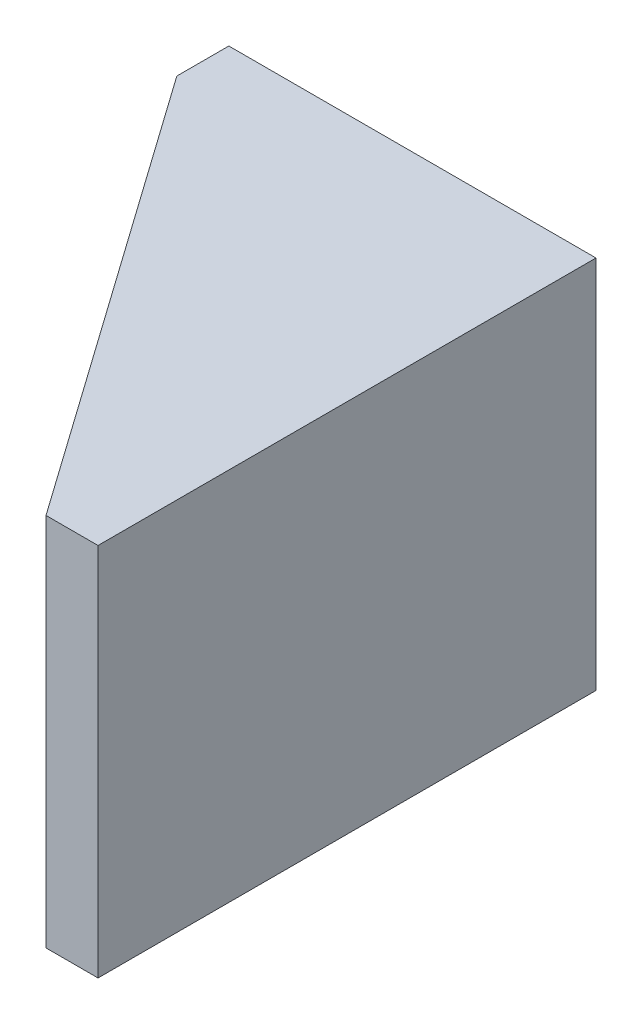
from build123d import *

# Parameters (mm, degrees)
BOSS_EXTRUDE1_DEPTH = 50.4
SKETCH3_R           = 11.5
SKETCH3_R_2         = 1.5
CUT_EXTRUDE1_DEPTH  = 90.095005472
BOSS_EXTRUDE2_DEPTH = 4


with BuildPart() as part:
    # Sketch2 → Boss-Extrude1 (new body)
    with BuildSketch(Plane(origin=(0, 0, 0), x_dir=(1, 0, 0), z_dir=(0, 1, 0))):
        Polygon((-42.4, 0), (0, 0), (0, -60), (7, -60), (7, 7), (-42.4, 7), align=None)
    extrude(amount=BOSS_EXTRUDE1_DEPTH)

    # Sketch3 → Cut-Extrude1 (cut, through all)
    with BuildSketch(Plane.XY):
        with Locations((-21.2, 25.2)):
            Circle(SKETCH3_R)
        with Locations((-36.7, 40.7)):
            Circle(SKETCH3_R_2)
        with Locations((-5.7, 40.7)):
            Circle(SKETCH3_R_2)
        with Locations((-5.7, 9.7)):
            Circle(SKETCH3_R_2)
        with Locations((-36.7, 9.7)):
            Circle(SKETCH3_R_2)
    extrude(amount=-CUT_EXTRUDE1_DEPTH, mode=Mode.SUBTRACT)

    # Sketch4 → Boss-Extrude2 (add)
    with BuildSketch(Plane(origin=(0, 50.4, 0), x_dir=(1, 0, 0), z_dir=(0, 1, 0))):
        Polygon((-42.4, 7), (7, 7), (7, -60), (0, -60), (-42.4, 0), align=None)
    boss_extrude2 = extrude(amount=-BOSS_EXTRUDE2_DEPTH)

    # Mirror1: Boss-Extrude2 across plane
    add(boss_extrude2.mirror(Plane.ZX.offset(25.2)))


solid = part.part
